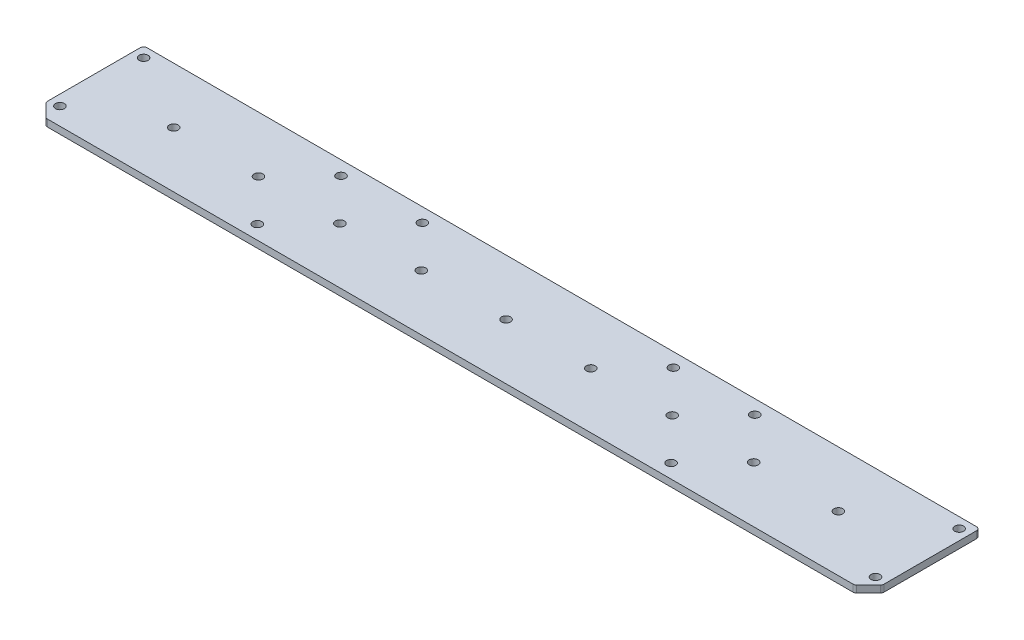
from build123d import *

# Parameters (mm, degrees)
BOSS_EXTRUDE1_DEPTH = 3.175
SKETCH3_R           = 2.032
CUT_EXTRUDE1_DEPTH  = 385.384860036
FILLET1_R           = 1.5875


with BuildPart() as part:
    # Sketch2 → Boss-Extrude1 (new body)
    with BuildSketch(Plane(origin=(0, 0, 0), x_dir=(1, 0, 0), z_dir=(0, 1, 0))):
        with BuildLine():
            Line((0, 7.00756403), (0, 50.8))
            Line((0, 50.8), (381, 50.8))
            Line((381, 50.8), (381, 7.00756403))
            ThreePointArc((381, 7.00756403), (380.879158758, 6.400054081), (380.535032015, 5.885032015))
            Line((380.535032015, 5.885032015), (375.114967985, 0.464967985))
            ThreePointArc((375.114967985, 0.464967985), (374.599945919, 0.120841242), (373.99243597, 0))
            Line((373.99243597, 0), (7.00756403, 0))
            ThreePointArc((7.00756403, 0), (6.400054081, 0.120841242), (5.885032015, 0.464967985))
            Line((5.885032015, 0.464967985), (0.464967985, 5.885032015))
            ThreePointArc((0.464967985, 5.885032015), (0.120841242, 6.400054081), (0, 7.00756403))
        make_face()
    extrude(amount=BOSS_EXTRUDE1_DEPTH)

    # Sketch3 → Cut-Extrude1 (cut, through all)
    with BuildSketch(Plane(origin=(0, 0, 0), x_dir=(1, 0, 0), z_dir=(0, 1, 0))):
        with Locations((4.7625, 7.9375)):
            Circle(SKETCH3_R)
        with Locations((4.7625, 46.0375)):
            Circle(SKETCH3_R)
        with Locations((376.2375, 7.9375)):
            Circle(SKETCH3_R)
        with Locations((376.2375, 46.0375)):
            Circle(SKETCH3_R)
        with Locations((341.884, 25.4)):
            Circle(SKETCH3_R)
        with Locations((247.65, 44.45)):
            Circle(SKETCH3_R)
        with Locations((284.734, 44.45)):
            Circle(SKETCH3_R)
        with Locations((284.734, 6.35)):
            Circle(SKETCH3_R)
        with Locations((190.5, 25.4)):
            Circle(SKETCH3_R)
        with Locations((133.35, 44.45)):
            Circle(SKETCH3_R)
        with Locations((96.266, 44.45)):
            Circle(SKETCH3_R)
        with Locations((96.266, 6.35)):
            Circle(SKETCH3_R)
        with Locations((77.724, 25.4)):
            Circle(SKETCH3_R)
        with Locations((39.116, 25.4)):
            Circle(SKETCH3_R)
        with Locations((151.892, 25.4)):
            Circle(SKETCH3_R)
        with Locations((229.108, 25.4)):
            Circle(SKETCH3_R)
        with Locations((266.192, 25.4)):
            Circle(SKETCH3_R)
        with Locations((303.276, 25.4)):
            Circle(SKETCH3_R)
        with Locations((114.808, 25.4)):
            Circle(SKETCH3_R)
    extrude(amount=CUT_EXTRUDE1_DEPTH, mode=Mode.SUBTRACT)

    # Fillet1
    fillet1_edges = [part.edges().sort_by_distance(p)[0] for p in [
        (0, 1.5875, -50.8),
        (381, 1.5875, -50.8),
    ]]
    fillet(fillet1_edges, radius=FILLET1_R)


solid = part.part
